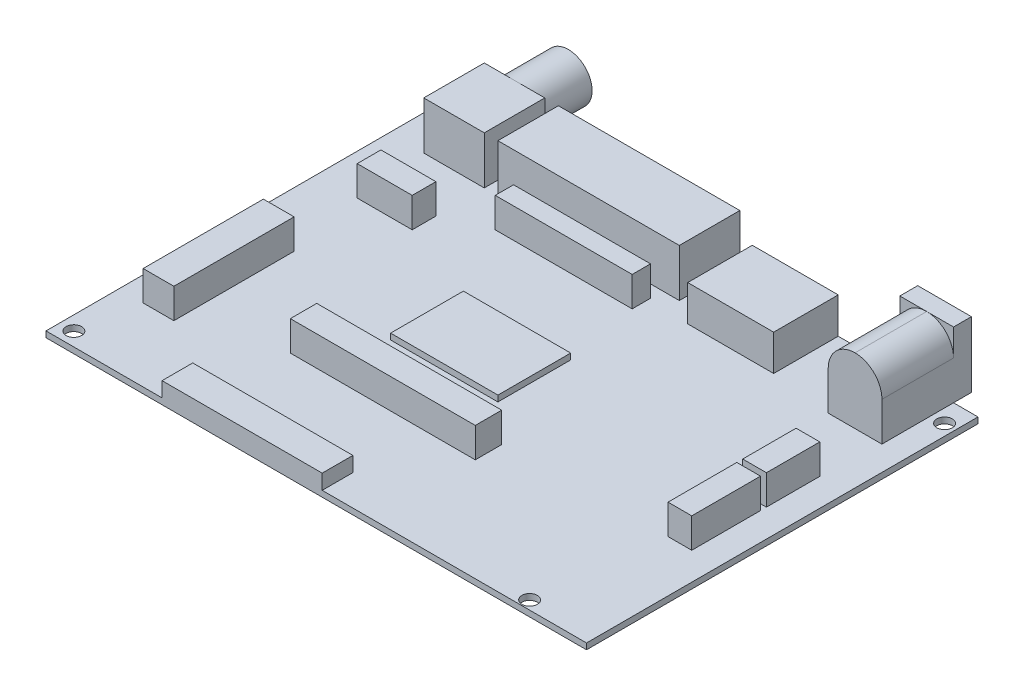
from build123d import *

# Parameters (mm, degrees)
SKETCH1_W            = 90.57
SKETCH1_H            = 65.6
BOSS_EXTRUDE1_DEPTH  = 1
SKETCH2_R            = 1.3
CUT_EXTRUDE1_DEPTH   = 112.835973193
SKETCH3_W            = 10.14
SKETCH3_H            = 10.14
SKETCH3_W_2          = 30.4
BOSS_EXTRUDE2_DEPTH  = 8
SKETCH4_W            = 14.4
SKETCH4_H            = 10.82
BOSS_EXTRUDE3_DEPTH  = 6
SKETCH5_W            = 9
SKETCH5_H            = 12
BOSS_EXTRUDE4_DEPTH  = 11
FILLET2_R            = 4.5
SKETCH7_W            = 9
SKETCH7_H            = 3
BOSS_EXTRUDE5_DEPTH  = 11
SKETCH8_R            = 4
BOSS_EXTRUDE6_DEPTH  = 9
SKETCH9_W            = 22.948138565
SKETCH9_H            = 3.071798075
SKETCH9_W_2          = 9.215394227
SKETCH9_H_2          = 3.975268097
SKETCH9_W_3          = 5.149779126
SKETCH9_H_3          = 20.147381496
SKETCH9_W_4          = 3.975268098
SKETCH9_H_4          = 8.94435322
SKETCH9_H_5          = 11.519242784
BOSS_EXTRUDE7_DEPTH  = 5
SKETCH10_W           = 17.979053442
SKETCH10_H           = 12.196845301
BOSS_EXTRUDE8_DEPTH  = 1
SKETCH12_W           = 26.83305966
SKETCH12_H           = 5.142650184
BOSS_EXTRUDE9_DEPTH  = 2.5
SKETCH13_W           = 30.989021763
SKETCH13_H           = 4.427003109
BOSS_EXTRUDE10_DEPTH = 5


with BuildPart() as part:
    # Sketch1 → Boss-Extrude1 (new body)
    with BuildSketch(Plane(origin=(0, 0, 0), x_dir=(1, 0, 0), z_dir=(0, 1, 0))):
        with Locations((45.285, 32.8)):
            Rectangle(SKETCH1_W, SKETCH1_H)
    extrude(amount=BOSS_EXTRUDE1_DEPTH)

    # Sketch2 → Cut-Extrude1 (cut, through all)
    with BuildSketch(Plane(origin=(0, 1, 0), x_dir=(1, 0, 0), z_dir=(0, 1, 0))):
        with Locations(Location((2.36, 2.31, 0), (0, 0, 270))):
            Circle(SKETCH2_R)
        with Locations(Location((3.099, 62.1, 0), (0, 0, 270))):
            Circle(SKETCH2_R)
        with Locations(Location((88.7, 61.87, 0), (0, 0, 270))):
            Circle(SKETCH2_R)
        with Locations(Location((79.55, 1.49, 0), (0, 0, 270))):
            Circle(SKETCH2_R)
    extrude(amount=-CUT_EXTRUDE1_DEPTH, mode=Mode.SUBTRACT)

    # Sketch3 → Boss-Extrude2 (add)
    with BuildSketch(Plane(origin=(0, 1, 0), x_dir=(1, 0, 0), z_dir=(0, 1, 0))):
        with Locations((10.91, 62.53)):
            Rectangle(SKETCH3_W, SKETCH3_H)
        with Locations((33.46, 62.53)):
            Rectangle(SKETCH3_W_2, SKETCH3_H)
    extrude(amount=BOSS_EXTRUDE2_DEPTH)

    # Sketch4 → Boss-Extrude3 (add)
    with BuildSketch(Plane(origin=(0, 1, 0), x_dir=(1, 0, 0), z_dir=(0, 1, 0))):
        with Locations((59.95, 60.19)):
            Rectangle(SKETCH4_W, SKETCH4_H)
    extrude(amount=BOSS_EXTRUDE3_DEPTH)

    # Sketch5 → Boss-Extrude4 (add)
    with BuildSketch(Plane(origin=(0, 1, 0), x_dir=(1, 0, 0), z_dir=(0, 1, 0))):
        with Locations((81.97, 59.6)):
            Rectangle(SKETCH5_W, SKETCH5_H)
    extrude(amount=BOSS_EXTRUDE4_DEPTH)

    # Fillet2
    fillet2_edges = [part.edges().sort_by_distance(p)[0] for p in [
        (86.47, 12, -59.6),
        (77.47, 12, -59.6),
    ]]
    fillet(fillet2_edges, radius=FILLET2_R - 0.0001)  # a hair under: the kernel refuses the full size

    # Sketch7 → Boss-Extrude5 (add)
    with BuildSketch(Plane(origin=(0, 1, 0), x_dir=(1, 0, 0), z_dir=(0, 1, 0))):
        with Locations((81.97, 67.1)):
            Rectangle(SKETCH7_W, SKETCH7_H)
    extrude(amount=BOSS_EXTRUDE5_DEPTH)

    # Sketch8 → Boss-Extrude6 (add)
    with BuildSketch(Plane(origin=(0, 0, -67.6), x_dir=(-1, 0, 0), z_dir=(0, 0, -1))):
        with Locations(Location((-10.91, 5, 0), (0, 0, 270))):
            Circle(SKETCH8_R)
    extrude(amount=BOSS_EXTRUDE6_DEPTH)

    # Sketch9 → Boss-Extrude7 (add)
    with BuildSketch(Plane(origin=(0, 1, 0), x_dir=(1, 0, 0), z_dir=(0, 1, 0))):
        with Locations((34.443359734, 53.839684383)):
            Rectangle(SKETCH9_W, SKETCH9_H)
        with Locations((11.404874166, 47.334700223)):
            Rectangle(SKETCH9_W_2, SKETCH9_H_2)
        with Locations((6.661656549, 22.263407105)):
            Rectangle(SKETCH9_W_3, SKETCH9_H_3)
        with Locations((83.953516952, 39.248643523)):
            Rectangle(SKETCH9_W_4, SKETCH9_H_4)
        with Locations((83.953516952, 28.023028497)):
            Rectangle(SKETCH9_W_4, SKETCH9_H_5)
    extrude(amount=BOSS_EXTRUDE7_DEPTH)

    # Sketch10 → Boss-Extrude8 (add)
    with BuildSketch(Plane(origin=(0, 1, 0), x_dir=(1, 0, 0), z_dir=(0, 1, 0))):
        with Locations((39.18657735, 33.647129386)):
            Rectangle(SKETCH10_W, SKETCH10_H)
    extrude(amount=BOSS_EXTRUDE8_DEPTH)

    # Sketch12 → Boss-Extrude9 (add)
    with BuildSketch(Plane(origin=(0, 1, 0), x_dir=(1, 0, 0), z_dir=(0, 1, 0))):
        with Locations((32.862287194, 2.571325092)):
            Rectangle(SKETCH12_W, SKETCH12_H)
    extrude(amount=BOSS_EXTRUDE9_DEPTH)

    # Sketch13 → Boss-Extrude10 (add)
    with BuildSketch(Plane(origin=(0, 1, 0), x_dir=(1, 0, 0), z_dir=(0, 1, 0))):
        with Locations((39.186577349, 19.462650037)):
            Rectangle(SKETCH13_W, SKETCH13_H)
    extrude(amount=BOSS_EXTRUDE10_DEPTH)


solid = part.part
